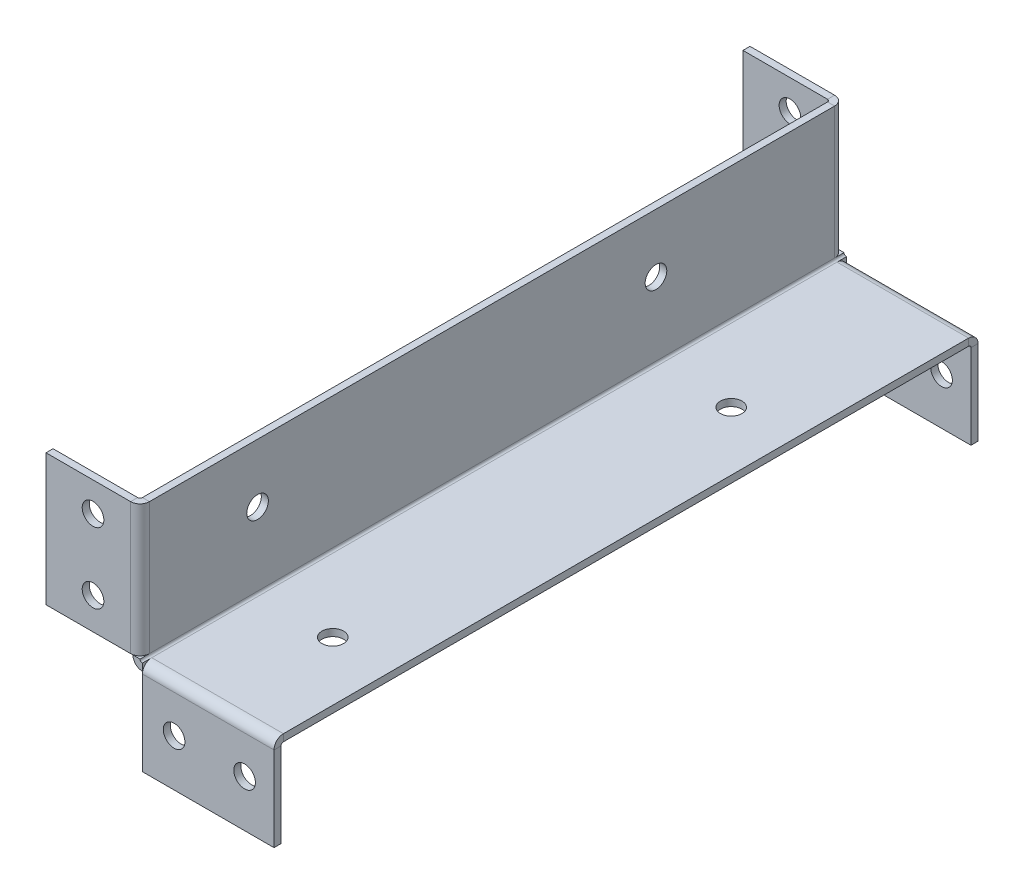
from build123d import *

# Parameters (mm, degrees)
SKETCH1_W                      = 60
SKETCH1_H                      = 299.5
BASE_FLANGE1_DEPTH             = 3
EDGE_FLANGE1_STRIP_W           = 14
EDGE_FLANGE1_STRIP_H           = 3
EDGE_FLANGE1_STRIP_CUT_DEPTH   = 299.5
EDGE_FLANGE1_DEPTH             = 299.5
EDGE_FLANGE2_STRIP_W           = 14
EDGE_FLANGE2_STRIP_H           = 3
EDGE_FLANGE2_STRIP_CUT_DEPTH   = 56
EDGE_FLANGE2_STRIP_2_W         = 14
EDGE_FLANGE2_STRIP_2_H         = 3
EDGE_FLANGE2_STRIP_CUT_2_DEPTH = 56
EDGE_FLANGE2_STRIP_3_W         = 14
EDGE_FLANGE2_STRIP_3_H         = 3
EDGE_FLANGE2_STRIP_CUT_3_DEPTH = 56
EDGE_FLANGE2_STRIP_4_W         = 14
EDGE_FLANGE2_STRIP_4_H         = 3
EDGE_FLANGE2_STRIP_CUT_4_DEPTH = 56
EDGE_FLANGE2_DEPTH             = 56
EDGE_FLANGE2_BEND_DEPTH        = 56
EDGE_FLANGE2_BEND_2_DEPTH      = 56
EDGE_FLANGE2_BEND_3_DEPTH      = 56
SKETCH18_R                     = 4.6
EXTRUDE1_DEPTH                 = 313.712727595
SKETCH19_R                     = 4.6
EXTRUDE2_DEPTH                 = 3
SKETCH20_R                     = 4.6
EXTRUDE3_DEPTH                 = 3


# Sheet-metal steps are written as plain solids
with BuildPart() as part:
    # Sketch1 → Base-Flange1 (new body)
    with BuildSketch(Plane(origin=(0, 0, 0), x_dir=(1, 0, 0), z_dir=(0, 1, 0))):
        Rectangle(SKETCH1_W, SKETCH1_H)
    extrude(amount=BASE_FLANGE1_DEPTH)

    # Edge-Flange1 strip (across the edge) → Edge-Flange1 strip cut (cut)
    with BuildSketch(Plane(origin=(-30, 3, -149.75), x_dir=(1, 0, 0), z_dir=(0, 0, 1))):
        with Locations((-3, -1.5)):
            Rectangle(EDGE_FLANGE1_STRIP_W, EDGE_FLANGE1_STRIP_H)
    extrude(amount=EDGE_FLANGE1_STRIP_CUT_DEPTH, mode=Mode.SUBTRACT)

    # Edge-Flange1 section (across the edge) → Edge-Flange1 (add)
    with BuildSketch(Plane(origin=(-30, 3, -149.75), x_dir=(1, 0, 0), z_dir=(0, 0, 1))):
        with BuildLine():
            Line((0, 1), (0, 57))
            Line((0, 57), (3, 57))
            Line((3, 57), (3, 1))
            ThreePointArc((3, 1), (3.292893219, 0.292893219), (4, 0))
            Line((4, 0), (4, -3))
            ThreePointArc((4, -3), (1.171572875, -1.828427125), (0, 1))
        make_face()
    extrude(amount=EDGE_FLANGE1_DEPTH)

    # Edge-Flange2 strip (across the edge) → Edge-Flange2 strip cut (cut)
    with BuildSketch(Plane(origin=(-30, 4, 149.75), x_dir=(0, 0, -1), z_dir=(0, 1, 0))):
        with Locations((-3, -1.5)):
            Rectangle(EDGE_FLANGE2_STRIP_W, EDGE_FLANGE2_STRIP_H)
    extrude(amount=EDGE_FLANGE2_STRIP_CUT_DEPTH, mode=Mode.SUBTRACT)

    # Edge-Flange2 strip 2 (across the edge) → Edge-Flange2 strip cut 2 (cut)
    with BuildSketch(Plane(origin=(30, 0, 149.75), x_dir=(0, 0, -1), z_dir=(-1, 0, 0))):
        with Locations((-3, -1.5)):
            Rectangle(EDGE_FLANGE2_STRIP_2_W, EDGE_FLANGE2_STRIP_2_H)
    extrude(amount=EDGE_FLANGE2_STRIP_CUT_2_DEPTH, mode=Mode.SUBTRACT)

    # Edge-Flange2 strip 3 (across the edge) → Edge-Flange2 strip cut 3 (cut)
    with BuildSketch(Plane(origin=(-30, 60, -149.75), x_dir=(0, 0, 1), z_dir=(0, -1, 0))):
        with Locations((-3, -1.5)):
            Rectangle(EDGE_FLANGE2_STRIP_3_W, EDGE_FLANGE2_STRIP_3_H)
    extrude(amount=EDGE_FLANGE2_STRIP_CUT_3_DEPTH, mode=Mode.SUBTRACT)

    # Edge-Flange2 strip 4 (across the edge) → Edge-Flange2 strip cut 4 (cut)
    with BuildSketch(Plane(origin=(-26, 0, -149.75), x_dir=(0, 0, 1), z_dir=(1, 0, 0))):
        with Locations((-3, -1.5)):
            Rectangle(EDGE_FLANGE2_STRIP_4_W, EDGE_FLANGE2_STRIP_4_H)
    extrude(amount=EDGE_FLANGE2_STRIP_CUT_4_DEPTH, mode=Mode.SUBTRACT)

    # Edge-Flange2 section (across the edge) → Edge-Flange2 (add)
    with BuildSketch(Plane(origin=(-30, 4, 149.75), x_dir=(0, 0, -1), z_dir=(0, 1, 0))):
        with BuildLine():
            Line((0, 1), (0, 37))
            Line((0, 37), (3, 37))
            Line((3, 37), (3, 1))
            ThreePointArc((3, 1), (3.292893219, 0.292893219), (4, 0))
            Line((4, 0), (4, -3))
            ThreePointArc((4, -3), (1.171572875, -1.828427125), (0, 1))
        make_face()
    extrude(amount=EDGE_FLANGE2_DEPTH)

    # Edge-Flange2 section 2 (across the edge) → Edge-Flange2 bend (add)
    with BuildSketch(Plane(origin=(30, 0, 149.75), x_dir=(0, 0, -1), z_dir=(-1, 0, 0))):
        with BuildLine():
            Line((0, 1), (0, 37))
            Line((0, 37), (3, 37))
            Line((3, 37), (3, 1))
            ThreePointArc((3, 1), (3.292893219, 0.292893219), (4, 0))
            Line((4, 0), (4, -3))
            ThreePointArc((4, -3), (1.171572875, -1.828427125), (0, 1))
        make_face()
    extrude(amount=EDGE_FLANGE2_BEND_DEPTH)

    # Edge-Flange2 section 3 (across the edge) → Edge-Flange2 bend 2 (add)
    with BuildSketch(Plane(origin=(-30, 60, -149.75), x_dir=(0, 0, 1), z_dir=(0, -1, 0))):
        with BuildLine():
            Line((0, 1), (0, 37))
            Line((0, 37), (3, 37))
            Line((3, 37), (3, 1))
            ThreePointArc((3, 1), (3.292893219, 0.292893219), (4, 0))
            Line((4, 0), (4, -3))
            ThreePointArc((4, -3), (1.171572875, -1.828427125), (0, 1))
        make_face()
    extrude(amount=EDGE_FLANGE2_BEND_2_DEPTH)

    # Edge-Flange2 section 4 (across the edge) → Edge-Flange2 bend 3 (add)
    with BuildSketch(Plane(origin=(-26, 0, -149.75), x_dir=(0, 0, 1), z_dir=(1, 0, 0))):
        with BuildLine():
            Line((0, 1), (0, 37))
            Line((0, 37), (3, 37))
            Line((3, 37), (3, 1))
            ThreePointArc((3, 1), (3.292893219, 0.292893219), (4, 0))
            Line((4, 0), (4, -3))
            ThreePointArc((4, -3), (1.171572875, -1.828427125), (0, 1))
        make_face()
    extrude(amount=EDGE_FLANGE2_BEND_3_DEPTH)

    # Sketch18 → Extrude1 (cut, through all)
    with BuildSketch(Plane.XY.offset(149.75)):
        with Locations((-47, 47.5)):
            Circle(SKETCH18_R)
        with Locations((-47, 17.5)):
            Circle(SKETCH18_R)
        with Locations((-12.5, -17)):
            Circle(SKETCH18_R)
        with Locations((17.5, -17)):
            Circle(SKETCH18_R)
    extrude(amount=-EXTRUDE1_DEPTH, mode=Mode.SUBTRACT)

    # Sketch19 → Extrude2 (cut)
    with BuildSketch(Plane(origin=(-27, 0, 0), x_dir=(0, 0, -1), z_dir=(1, 0, 0))):
        with Locations(Location((-99.75, 35, 0), (0, 0, 90))):
            Circle(SKETCH19_R)
        with Locations(Location((69.75, 35, 0), (0, 0, 90))):
            Circle(SKETCH19_R)
    extrude(amount=-EXTRUDE2_DEPTH, mode=Mode.SUBTRACT)

    # Sketch20 → Extrude3 (cut)
    with BuildSketch(Plane(origin=(0, 3, 0), x_dir=(1, 0, 0), z_dir=(0, 1, 0))):
        with Locations(Location((5, 69.75, 0), (0, 0, 270))):
            Circle(SKETCH20_R)
        with Locations(Location((5, -99.75, 0), (0, 0, 270))):
            Circle(SKETCH20_R)
    extrude(amount=-EXTRUDE3_DEPTH, mode=Mode.SUBTRACT)


solid = part.part
